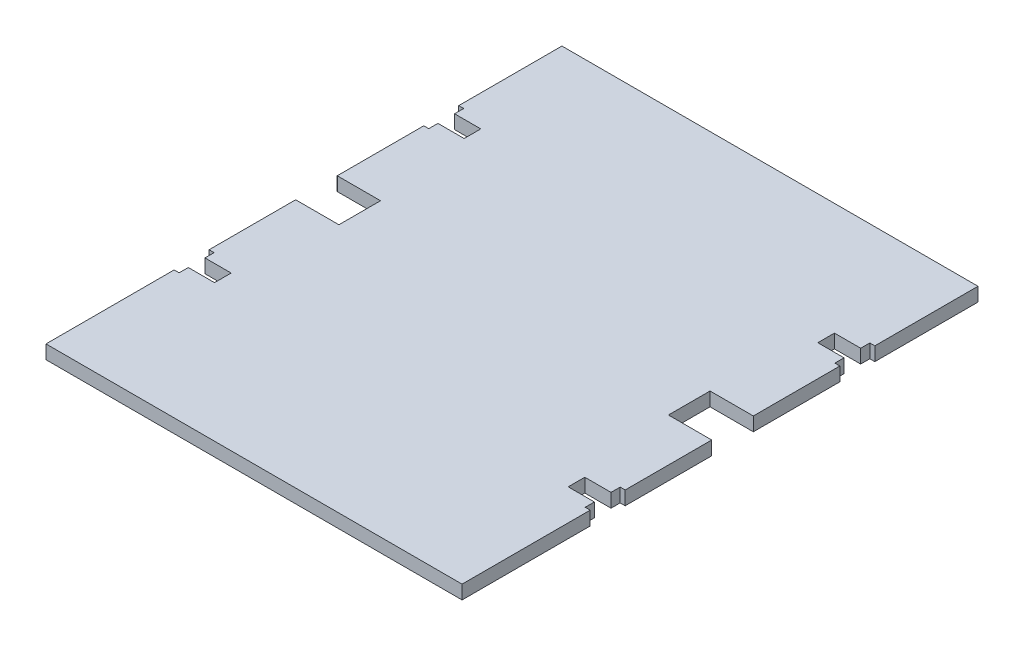
from build123d import *

# Parameters (mm, degrees)
SKETCH1_W           = 500
SKETCH1_H           = 620
BOSS_EXTRUDE1_DEPTH = 16.5
SKETCH2_W           = 52
SKETCH2_H           = 50
CUT_EXTRUDE1_DEPTH  = 399.587819683


with BuildPart() as part:
    # Sketch1 → Boss-Extrude1 (new body)
    with BuildSketch(Plane(origin=(0, 0, 0), x_dir=(1, 0, 0), z_dir=(0, 1, 0))):
        Rectangle(SKETCH1_W, SKETCH1_H)
    extrude(amount=BOSS_EXTRUDE1_DEPTH)

    # Sketch2 → Cut-Extrude1 (cut, through all)
    with BuildSketch(Plane(origin=(0, 16.5, 0), x_dir=(1, 0, 0), z_dir=(0, 1, 0))):
        with Locations((-224, 15)):
            Rectangle(SKETCH2_W, SKETCH2_H)
        with Locations((224, 15)):
            Rectangle(SKETCH2_W, SKETCH2_H)
        Polygon((-250, 186), (-244, 186), (-244, 175), (-212.5, 175), (-212.5, 155), (-244, 155), (-244, 144), (-250, 144), align=None)
        Polygon((212.5, 175), (212.5, 155), (244, 155), (244, 144), (250, 144), (250, 186), (244, 186), (244, 175), align=None)
        Polygon((212.5, -125), (212.5, -145), (244, -145), (244, -156), (250, -156), (250, -114), (244, -114), (244, -125), align=None)
        Polygon((-250, -114), (-244, -114), (-244, -125), (-212.5, -125), (-212.5, -145), (-244, -145), (-244, -156), (-250, -156), align=None)
    extrude(amount=-CUT_EXTRUDE1_DEPTH, mode=Mode.SUBTRACT)


solid = part.part
